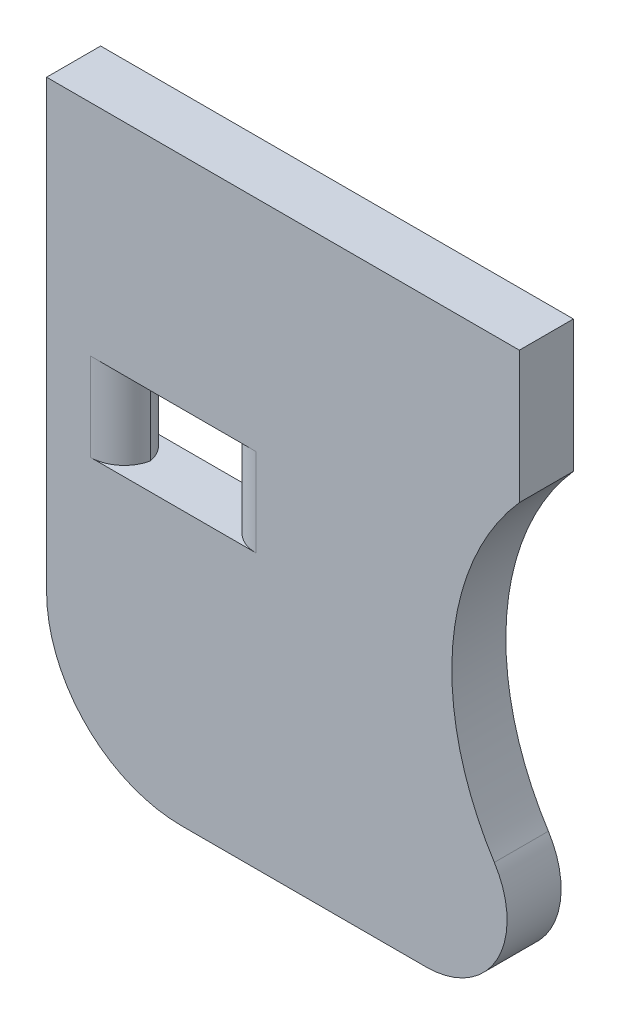
from build123d import *

# Parameters (mm, degrees)
BOSS_EXTRU_1_DEPTH      = 4
ESQUISSE2_W             = 7.25
ESQUISSE2_H             = 6.5
ENL_V_MAT_EXTRU_1_DEPTH = 96.785571069
CONG_1_R                = 2.5
CUT_EXTRUDE1_REACH      = 97.786


with BuildPart() as part:
    # Esquisse1 → Boss.-Extru.1 (new body)
    with BuildSketch(Plane.XY):
        with BuildLine():
            Line((-34.444097209, -52.025), (-34.444097209, -52.525))
            Line((-34.444097209, -52.525), (-70, -52.525))
            ThreePointArc((-70, -52.525), (-77.071067812, -49.596067812), (-80, -42.525))
            Line((-80, -42.525), (-80, -9.525))
            Line((-80, -9.525), (-45, -9.525))
            Line((-45, -9.525), (-45, -19.296243445))
            ThreePointArc((-45, -19.296243445), (-49.034471505, -38.664128156), (-34.444097209, -52.025))
        make_face()
    extrude(amount=BOSS_EXTRU_1_DEPTH)

    # Esquisse2 → Enlèv. mat.-Extru.1 (cut, through all)
    with BuildSketch(Plane(origin=(0, 0, 0), x_dir=(-1, 0, 0), z_dir=(0, 0, -1))):
        with Locations((70.625, -29.025)):
            Rectangle(ESQUISSE2_W, ESQUISSE2_H)
    extrude(amount=-ENL_V_MAT_EXTRU_1_DEPTH, mode=Mode.SUBTRACT)

    # Congé1
    # the kernel refuses this fillet: 2.5 mm, written as the material it takes off along each edge
    with BuildSketch(Plane(origin=(-74.25, -25.775, 4), x_dir=(-1, 0, 0), z_dir=(0, -1, 0)), Plane(origin=(-67, -32.275, 4), x_dir=(1, 0, 0), z_dir=(0, 1, 0))) as cong_1_piece_1:
        with BuildLine():
            CenterArc((CONG_1_R, CONG_1_R), CONG_1_R, 180, 90)
            Line((0, CONG_1_R), (0, 0))
            Line((0, 0), (CONG_1_R, 0))
        make_face()
    extrude(amount=6.5, mode=Mode.SUBTRACT)
    with BuildSketch(Plane(origin=(-74.25, -25.775, 0), x_dir=(-1, 0, 0), z_dir=(0, -1, 0)), Plane(origin=(-67, -32.275, 0), x_dir=(1, 0, 0), z_dir=(0, 1, 0))) as cong_1_piece_2:
        with BuildLine():
            CenterArc((CONG_1_R, -CONG_1_R), CONG_1_R, 90, 90)
            Line((0, -CONG_1_R), (0, 0))
            Line((0, 0), (CONG_1_R, 0))
        make_face()
    extrude(amount=6.5, mode=Mode.SUBTRACT)

    # Sketch1 → Cut-Extrude1 (cut, up to next)
    with BuildSketch(Plane(origin=(0, 0, 0), x_dir=(-1, 0, 0), z_dir=(0, 0, -1)), mode=Mode.PRIVATE) as cut_extrude1_sk1:
        with BuildLine():
            Line((51.9089023, -52.525), (34.444097209, -52.525))
            Line((34.444097209, -52.525), (34.444097209, -52.025))
            Line((34.444097209, -52.025), (46.853001769, -43.294230769))
            ThreePointArc((46.853001769, -43.294230769), (46.646554184, -49.407306768), (51.9089023, -52.525))
        make_face()
    cut_extrude1_tool1 = extrude(cut_extrude1_sk1.sketch, amount=-CUT_EXTRUDE1_REACH, mode=Mode.PRIVATE) & part.part
    add(cut_extrude1_tool1.solids().sort_by_distance((-42.611695, -49.79665, 0))[0], mode=Mode.SUBTRACT)


solid = part.part
